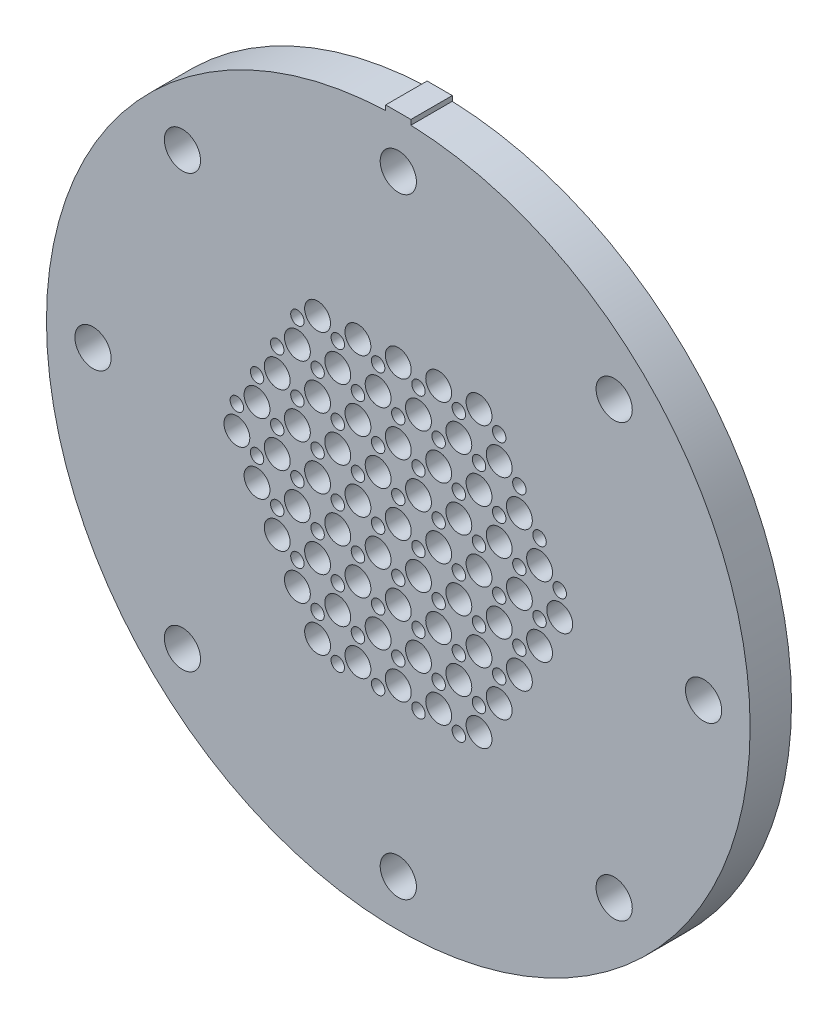
from build123d import *

# Parameters (mm, degrees)
SKETCH1_R               = 20
SKETCH1_R_2             = 1.25
SKETCH1_R_3             = 0.65
SKETCH5_R               = 34
SKETCH5_R_2             = 17.173669099
BOSS_EXTRUDE1_DEPTH     = 4
FILLET1_R               = 2
SKETCH8_R               = 1.75
CUT_EXTRUDE3_DEPTH      = 5
SKETCH10_W              = 107.605507763
SKETCH10_H              = 80.053599659
CUT_EXTRUDE4_DEPTH      = 50
SKETCH18_R              = 24
SKETCH18_R_2            = 19
CUT_EXTRUDE6_DEPTH      = 80.771517757
CUT_EXTRUDE6_DEPTH_BACK = 80.771517757
SKETCH21_R              = 20.75
CUT_EXTRUDE7_DEPTH      = 4.55
SKETCH23_R              = 30.729548531
SKETCH23_R_2            = 22.729548531
BOSS_EXTRUDE2_DEPTH     = 2.5
SKETCH24_R              = 1.6
CUT_EXTRUDE8_DEPTH      = 2.5
SKETCH27_R              = 1.75
CUT_EXTRUDE9_DEPTH      = 5
SKETCH28_W              = 2.436031958
SKETCH28_H              = 0.92316818
BOSS_EXTRUDE3_DEPTH     = 4
SKETCH29_W              = 114.781265496
SKETCH29_H              = 149.582619024
SKETCH29_W_2            = 53
SKETCH29_H_2            = 123.630711616
CUT_EXTRUDE10_DEPTH     = 3
SKETCH30_R              = 44.806445858
CUT_EXTRUDE11_DEPTH     = 60


with BuildPart() as part:
    # Sweep1: sweep along a path in Sketch2
    with BuildLine(Plane(origin=(0, 0, 0), x_dir=(0, 0, -1), z_dir=(1, 0, 0))) as sweep1_path:
        Line((0, 0), (12, 0))
        ThreePointArc((12, 0), (31.391260893, -8.032123253), (39.423384146, -27.423384146))
        Line((39.423384146, -27.423384146), (39.423384146, -34.423384146))
    # Sketch1 → Sweep1 (sweep)
    with BuildSketch(Plane.XY):
        Circle(SKETCH1_R)
        Circle(SKETCH1_R_2, mode=Mode.SUBTRACT)
        with Locations((3.9, 0)):
            Circle(SKETCH1_R_2, mode=Mode.SUBTRACT)
        with Locations((7.8, 0)):
            Circle(SKETCH1_R_2, mode=Mode.SUBTRACT)
        with Locations((11.7, 0)):
            Circle(SKETCH1_R_2, mode=Mode.SUBTRACT)
        with Locations((15.6, 0)):
            Circle(SKETCH1_R_2, mode=Mode.SUBTRACT)
        with Locations((1.95, -3.377499075)):
            Circle(SKETCH1_R_2, mode=Mode.SUBTRACT)
        with Locations((3.9, -6.75499815)):
            Circle(SKETCH1_R_2, mode=Mode.SUBTRACT)
        with Locations((5.85, -10.132497224)):
            Circle(SKETCH1_R_2, mode=Mode.SUBTRACT)
        with Locations((7.8, -13.509996299)):
            Circle(SKETCH1_R_2, mode=Mode.SUBTRACT)
        with Locations((-1.95, -3.377499075)):
            Circle(SKETCH1_R_2, mode=Mode.SUBTRACT)
        with Locations((-3.9, -6.75499815)):
            Circle(SKETCH1_R_2, mode=Mode.SUBTRACT)
        with Locations((-5.85, -10.132497224)):
            Circle(SKETCH1_R_2, mode=Mode.SUBTRACT)
        with Locations((-7.8, -13.509996299)):
            Circle(SKETCH1_R_2, mode=Mode.SUBTRACT)
        with Locations((-3.9, 0)):
            Circle(SKETCH1_R_2, mode=Mode.SUBTRACT)
        with Locations((-7.8, 0)):
            Circle(SKETCH1_R_2, mode=Mode.SUBTRACT)
        with Locations((-11.7, 0)):
            Circle(SKETCH1_R_2, mode=Mode.SUBTRACT)
        with Locations((-15.6, 0)):
            Circle(SKETCH1_R_2, mode=Mode.SUBTRACT)
        with Locations((-1.95, 3.377499075)):
            Circle(SKETCH1_R_2, mode=Mode.SUBTRACT)
        with Locations((-3.9, 6.75499815)):
            Circle(SKETCH1_R_2, mode=Mode.SUBTRACT)
        with Locations((-5.85, 10.132497224)):
            Circle(SKETCH1_R_2, mode=Mode.SUBTRACT)
        with Locations((-7.8, 13.509996299)):
            Circle(SKETCH1_R_2, mode=Mode.SUBTRACT)
        with Locations((1.95, 3.377499075)):
            Circle(SKETCH1_R_2, mode=Mode.SUBTRACT)
        with Locations((3.9, 6.75499815)):
            Circle(SKETCH1_R_2, mode=Mode.SUBTRACT)
        with Locations((5.85, 10.132497224)):
            Circle(SKETCH1_R_2, mode=Mode.SUBTRACT)
        with Locations((7.8, 13.509996299)):
            Circle(SKETCH1_R_2, mode=Mode.SUBTRACT)
        with Locations((5.85, 3.377499075)):
            Circle(SKETCH1_R_2, mode=Mode.SUBTRACT)
        with Locations((7.8, 6.75499815)):
            Circle(SKETCH1_R_2, mode=Mode.SUBTRACT)
        with Locations((9.75, 3.377499075)):
            Circle(SKETCH1_R_2, mode=Mode.SUBTRACT)
        with Locations((11.7, 6.75499815)):
            Circle(SKETCH1_R_2, mode=Mode.SUBTRACT)
        with Locations((9.749099848, 10.134056333)):
            Circle(SKETCH1_R_2, mode=Mode.SUBTRACT)
        with Locations((13.650900152, 3.375939966)):
            Circle(SKETCH1_R_2, mode=Mode.SUBTRACT)
        with Locations((5.850000208, -3.379058003)):
            Circle(SKETCH1_R_2, mode=Mode.SUBTRACT)
        with Locations((9.750000208, -3.379058003)):
            Circle(SKETCH1_R_2, mode=Mode.SUBTRACT)
        with Locations((7.800000208, -6.756557078)):
            Circle(SKETCH1_R_2, mode=Mode.SUBTRACT)
        with Locations((11.700000208, -6.756557078)):
            Circle(SKETCH1_R_2, mode=Mode.SUBTRACT)
        with Locations((9.749100056, -10.135615261)):
            Circle(SKETCH1_R_2, mode=Mode.SUBTRACT)
        with Locations((13.650900359, -3.377498895)):
            Circle(SKETCH1_R_2, mode=Mode.SUBTRACT)
        with Locations((-0.00134976, -6.757336722)):
            Circle(SKETCH1_R_2, mode=Mode.SUBTRACT)
        with Locations((1.94865024, -10.134835797)):
            Circle(SKETCH1_R_2, mode=Mode.SUBTRACT)
        with Locations((-1.95134976, -10.134835797)):
            Circle(SKETCH1_R_2, mode=Mode.SUBTRACT)
        with Locations((-0.00134976, -13.512334872)):
            Circle(SKETCH1_R_2, mode=Mode.SUBTRACT)
        with Locations((-3.903150063, -13.512334872)):
            Circle(SKETCH1_R_2, mode=Mode.SUBTRACT)
        with Locations((3.900450543, -13.512334872)):
            Circle(SKETCH1_R_2, mode=Mode.SUBTRACT)
        with Locations((-5.852699936, -3.379058363)):
            Circle(SKETCH1_R_2, mode=Mode.SUBTRACT)
        with Locations((-7.802699936, -6.756557438)):
            Circle(SKETCH1_R_2, mode=Mode.SUBTRACT)
        with Locations((-9.752699936, -3.379058363)):
            Circle(SKETCH1_R_2, mode=Mode.SUBTRACT)
        with Locations((-11.702699936, -6.756557438)):
            Circle(SKETCH1_R_2, mode=Mode.SUBTRACT)
        with Locations((-13.653600087, -3.377499255)):
            Circle(SKETCH1_R_2, mode=Mode.SUBTRACT)
        with Locations((-9.751799784, -10.135615621)):
            Circle(SKETCH1_R_2, mode=Mode.SUBTRACT)
        with Locations((-5.852700144, 3.377498715)):
            Circle(SKETCH1_R_2, mode=Mode.SUBTRACT)
        with Locations((-9.752700144, 3.377498715)):
            Circle(SKETCH1_R_2, mode=Mode.SUBTRACT)
        with Locations((-7.802700144, 6.75499779)):
            Circle(SKETCH1_R_2, mode=Mode.SUBTRACT)
        with Locations((-11.702700144, 6.75499779)):
            Circle(SKETCH1_R_2, mode=Mode.SUBTRACT)
        with Locations((-9.751799992, 10.134055973)):
            Circle(SKETCH1_R_2, mode=Mode.SUBTRACT)
        with Locations((-13.653600295, 3.375939606)):
            Circle(SKETCH1_R_2, mode=Mode.SUBTRACT)
        with Locations((-0.001350176, 6.755777434)):
            Circle(SKETCH1_R_2, mode=Mode.SUBTRACT)
        with Locations((-1.951350176, 10.133276509)):
            Circle(SKETCH1_R_2, mode=Mode.SUBTRACT)
        with Locations((1.948649824, 10.133276509)):
            Circle(SKETCH1_R_2, mode=Mode.SUBTRACT)
        with Locations((-0.001350176, 13.510775583)):
            Circle(SKETCH1_R_2, mode=Mode.SUBTRACT)
        with Locations((3.900450128, 13.510775583)):
            Circle(SKETCH1_R_2, mode=Mode.SUBTRACT)
        with Locations((-3.903150479, 13.510775583)):
            Circle(SKETCH1_R_2, mode=Mode.SUBTRACT)
        with Locations((13.65, -1.125833025)):
            Circle(SKETCH1_R_3, mode=Mode.SUBTRACT)
        with Locations((11.700900359, -4.504371325)):
            Circle(SKETCH1_R_3, mode=Mode.SUBTRACT)
        with Locations((9.750000208, -7.883429509)):
            Circle(SKETCH1_R_3, mode=Mode.SUBTRACT)
        with Locations((7.798650344, -11.259109473)):
            Circle(SKETCH1_R_3, mode=Mode.SUBTRACT)
        with Locations((9.75, -1.125833025)):
            Circle(SKETCH1_R_3, mode=Mode.SUBTRACT)
        with Locations((7.800900359, -4.504371325)):
            Circle(SKETCH1_R_3, mode=Mode.SUBTRACT)
        with Locations((5.850000208, -7.883429509)):
            Circle(SKETCH1_R_3, mode=Mode.SUBTRACT)
        with Locations((3.898650344, -11.259109473)):
            Circle(SKETCH1_R_3, mode=Mode.SUBTRACT)
        with Locations((5.85, -1.125833025)):
            Circle(SKETCH1_R_3, mode=Mode.SUBTRACT)
        with Locations((3.900900359, -4.504371325)):
            Circle(SKETCH1_R_3, mode=Mode.SUBTRACT)
        with Locations((1.950000208, -7.883429509)):
            Circle(SKETCH1_R_3, mode=Mode.SUBTRACT)
        with Locations((-0.001349656, -11.259109473)):
            Circle(SKETCH1_R_3, mode=Mode.SUBTRACT)
        with Locations((1.95, -1.125833025)):
            Circle(SKETCH1_R_3, mode=Mode.SUBTRACT)
        with Locations((0.000900359, -4.504371325)):
            Circle(SKETCH1_R_3, mode=Mode.SUBTRACT)
        with Locations((-1.949999792, -7.883429509)):
            Circle(SKETCH1_R_3, mode=Mode.SUBTRACT)
        with Locations((-3.901349656, -11.259109473)):
            Circle(SKETCH1_R_3, mode=Mode.SUBTRACT)
        with Locations((-1.95, -1.125833025)):
            Circle(SKETCH1_R_3, mode=Mode.SUBTRACT)
        with Locations((-3.899099641, -4.504371325)):
            Circle(SKETCH1_R_3, mode=Mode.SUBTRACT)
        with Locations((-5.849999792, -7.883429509)):
            Circle(SKETCH1_R_3, mode=Mode.SUBTRACT)
        with Locations((-7.801349656, -11.259109473)):
            Circle(SKETCH1_R_3, mode=Mode.SUBTRACT)
        with Locations((-5.85, -1.125833025)):
            Circle(SKETCH1_R_3, mode=Mode.SUBTRACT)
        with Locations((-7.799099641, -4.504371325)):
            Circle(SKETCH1_R_3, mode=Mode.SUBTRACT)
        with Locations((-9.749999792, -7.883429509)):
            Circle(SKETCH1_R_3, mode=Mode.SUBTRACT)
        with Locations((-9.75, -1.125833025)):
            Circle(SKETCH1_R_3, mode=Mode.SUBTRACT)
        with Locations((-11.699099641, -4.504371325)):
            Circle(SKETCH1_R_3, mode=Mode.SUBTRACT)
        with Locations((-13.65, -1.125833025)):
            Circle(SKETCH1_R_3, mode=Mode.SUBTRACT)
        with Locations((0, 2.25166605)):
            Circle(SKETCH1_R_3, mode=Mode.SUBTRACT)
        with Locations((3.9, 2.25166605)):
            Circle(SKETCH1_R_3, mode=Mode.SUBTRACT)
        with Locations((7.8, 2.25166605)):
            Circle(SKETCH1_R_3, mode=Mode.SUBTRACT)
        with Locations((11.7, 2.25166605)):
            Circle(SKETCH1_R_3, mode=Mode.SUBTRACT)
        with Locations((15.6, 2.25166605)):
            Circle(SKETCH1_R_3, mode=Mode.SUBTRACT)
        with Locations((1.949100056, 5.629684708)):
            Circle(SKETCH1_R_3, mode=Mode.SUBTRACT)
        with Locations((5.849100056, 5.629684708)):
            Circle(SKETCH1_R_3, mode=Mode.SUBTRACT)
        with Locations((9.749100056, 5.629684708)):
            Circle(SKETCH1_R_3, mode=Mode.SUBTRACT)
        with Locations((13.649100056, 5.629684708)):
            Circle(SKETCH1_R_3, mode=Mode.SUBTRACT)
        with Locations((3.899100056, 9.007183782)):
            Circle(SKETCH1_R_3, mode=Mode.SUBTRACT)
        with Locations((7.799100056, 9.007183782)):
            Circle(SKETCH1_R_3, mode=Mode.SUBTRACT)
        with Locations((11.699100056, 9.007183782)):
            Circle(SKETCH1_R_3, mode=Mode.SUBTRACT)
        with Locations((5.85, 12.384163274)):
            Circle(SKETCH1_R_3, mode=Mode.SUBTRACT)
        with Locations((9.75, 12.384163274)):
            Circle(SKETCH1_R_3, mode=Mode.SUBTRACT)
        with Locations((5.85, -14.635829324)):
            Circle(SKETCH1_R_3, mode=Mode.SUBTRACT)
        with Locations((1.950899944, -14.635309741)):
            Circle(SKETCH1_R_3, mode=Mode.SUBTRACT)
        with Locations((-1.949100056, -14.635309741)):
            Circle(SKETCH1_R_3, mode=Mode.SUBTRACT)
        with Locations((-5.85, -14.635829324)):
            Circle(SKETCH1_R_3, mode=Mode.SUBTRACT)
        with Locations((-15.6, 2.25166605)):
            Circle(SKETCH1_R_3, mode=Mode.SUBTRACT)
        with Locations((-13.65, 5.628125959)):
            Circle(SKETCH1_R_3, mode=Mode.SUBTRACT)
        with Locations((-11.7, 9.005625033)):
            Circle(SKETCH1_R_3, mode=Mode.SUBTRACT)
        with Locations((-9.75, 12.384163274)):
            Circle(SKETCH1_R_3, mode=Mode.SUBTRACT)
        with Locations((-5.85, 12.384163274)):
            Circle(SKETCH1_R_3, mode=Mode.SUBTRACT)
        with Locations((-1.95, 12.384163274)):
            Circle(SKETCH1_R_3, mode=Mode.SUBTRACT)
        with Locations((1.95, 12.384163274)):
            Circle(SKETCH1_R_3, mode=Mode.SUBTRACT)
        with Locations((-7.8, 9.005625033)):
            Circle(SKETCH1_R_3, mode=Mode.SUBTRACT)
        with Locations((-9.75, 5.628125959)):
            Circle(SKETCH1_R_3, mode=Mode.SUBTRACT)
        with Locations((-11.7, 2.25166605)):
            Circle(SKETCH1_R_3, mode=Mode.SUBTRACT)
        with Locations((-3.9, 9.005625033)):
            Circle(SKETCH1_R_3, mode=Mode.SUBTRACT)
        with Locations((-5.85, 5.628125959)):
            Circle(SKETCH1_R_3, mode=Mode.SUBTRACT)
        with Locations((-7.8, 2.25166605)):
            Circle(SKETCH1_R_3, mode=Mode.SUBTRACT)
        with Locations((0, 9.005625033)):
            Circle(SKETCH1_R_3, mode=Mode.SUBTRACT)
        with Locations((-1.95, 5.628125959)):
            Circle(SKETCH1_R_3, mode=Mode.SUBTRACT)
        with Locations((-3.9, 2.25166605)):
            Circle(SKETCH1_R_3, mode=Mode.SUBTRACT)
    sweep(path=sweep1_path.line)

    # Sketch5 → Boss-Extrude1 (add)
    with BuildSketch(Plane.XY):
        Circle(SKETCH5_R)
        Circle(SKETCH5_R_2, mode=Mode.SUBTRACT)
    extrude(amount=-BOSS_EXTRUDE1_DEPTH)

    # Fillet1
    fillet1_edges = [part.edges().sort_by_distance(p)[0] for p in [
        (-20, 0, -4),
    ]]
    fillet(fillet1_edges, radius=FILLET1_R)

    # Sketch8 → Cut-Extrude3 (cut)
    with BuildSketch(Plane.XY):
        with Locations((-20.859650045, 20.859650045)):
            Circle(SKETCH8_R)
        with Locations((20.859650045, 20.859650045)):
            Circle(SKETCH8_R)
        with Locations((20.859650045, -20.859650045)):
            Circle(SKETCH8_R)
        with Locations((-20.859650045, -20.859650045)):
            Circle(SKETCH8_R)
    extrude(amount=-CUT_EXTRUDE3_DEPTH, mode=Mode.SUBTRACT)

    # Sketch10 → Cut-Extrude4 (cut)
    with BuildSketch(Plane.XY.offset(-10)):
        with Locations((7.049168622, 0.788612068)):
            Rectangle(SKETCH10_W, SKETCH10_H)
    extrude(amount=-CUT_EXTRUDE4_DEPTH, mode=Mode.SUBTRACT)

    # Sweep2: sweep along a path in Sketch2<2>
    with BuildLine(Plane(origin=(0, 0, 0), x_dir=(0, 0, -1), z_dir=(1, 0, 0))) as sweep2_path:
        Line((0, 0), (12, 0))
        ThreePointArc((12, 0), (31.391260893, -8.032123253), (39.423384146, -27.423384146))
        Line((39.423384146, -27.423384146), (39.423384146, -34.423384146))
    # Sketch18 → Sweep2 (sweep)
    with BuildSketch(Plane.XY):
        Circle(SKETCH18_R)
        Circle(SKETCH18_R_2, mode=Mode.SUBTRACT)
    sweep(path=sweep2_path.line)

    # Sketch9 → Cut-Extrude6 (cut, two sides: drawn at the far end of the back side and taken through both)
    with BuildSketch(Plane(origin=(0, 0, 0), x_dir=(0, 0, -1), z_dir=(1, 0, 0)).offset(-CUT_EXTRUDE6_DEPTH_BACK)):
        Polygon((17.249125269, -22.174258877), (55.092197309, 18.379670426), (79.742003971, -4.62240176), (81.44279688, -51.391669716), (9.251283321, -51.391669716), (8.528618039, -31.519452452), align=None)
    extrude(amount=CUT_EXTRUDE6_DEPTH + CUT_EXTRUDE6_DEPTH_BACK, mode=Mode.SUBTRACT)

    # Sketch21 → Cut-Extrude7 (cut)
    with BuildSketch(Plane(origin=(0, -18.92525353, -20.280948462), x_dir=(-1, 0, 0), z_dir=(0, -0.6822482773295654, -0.7311205701393174))):
        with Locations((0.001350176, 15.34834156)):
            Circle(SKETCH21_R)
    extrude(amount=-CUT_EXTRUDE7_DEPTH, mode=Mode.SUBTRACT)

    # Sketch23 → Boss-Extrude2 (add)
    with BuildSketch(Plane(origin=(0, -18.92525353, -20.280948462), x_dir=(-1, 0, 0), z_dir=(0, -0.6822482773295654, -0.7311205701393174))):
        with Locations((0.001350176, 15.786588008)):
            Circle(SKETCH23_R)
        with Locations((0.001350176, 15.786588008)):
            Circle(SKETCH23_R_2, mode=Mode.SUBTRACT)
    extrude(amount=-BOSS_EXTRUDE2_DEPTH)

    # Sketch24 → Cut-Extrude8 (cut)
    with BuildSketch(Plane(origin=(0, -17.219632836, -18.453147036), x_dir=(1, 0, 0), z_dir=(0, 0.6822482773295654, 0.7311205701393173))):
        with Locations((-2.53e-06, 42.787822162)):
            Circle(SKETCH24_R)
        with Locations((23.38200952, 29.286655083)):
            Circle(SKETCH24_R)
        with Locations((23.380661875, 2.286655117)):
            Circle(SKETCH24_R)
        with Locations((-0.002697821, -11.212177771)):
            Circle(SKETCH24_R)
        with Locations((-23.384709872, 2.288989308)):
            Circle(SKETCH24_R)
        with Locations((-23.383362226, 29.288989274)):
            Circle(SKETCH24_R)
    extrude(amount=-CUT_EXTRUDE8_DEPTH, mode=Mode.SUBTRACT)

    # Sketch27 → Cut-Extrude9 (cut)
    with BuildSketch(Plane.XY):
        with Locations((0, 29.5)):
            Circle(SKETCH27_R)
        with Locations((29.5, 0)):
            Circle(SKETCH27_R)
        with Locations((0, -29.5)):
            Circle(SKETCH27_R)
        with Locations((-29.5, 0)):
            Circle(SKETCH27_R)
    extrude(amount=-CUT_EXTRUDE9_DEPTH, mode=Mode.SUBTRACT)

    # Sketch28 → Boss-Extrude3 (add)
    with BuildSketch(Plane.XY):
        with Locations((0, 34)):
            Rectangle(SKETCH28_W, SKETCH28_H)
    extrude(amount=-BOSS_EXTRUDE3_DEPTH)

    # Sketch29 → Cut-Extrude10 (cut)
    with BuildSketch(Plane(origin=(0, -18.92525353, -20.280948462), x_dir=(-1, 0, 0), z_dir=(0, -0.6822482773295654, -0.7311205701393174))):
        Rectangle(SKETCH29_W, SKETCH29_H)
        Rectangle(SKETCH29_W_2, SKETCH29_H_2, mode=Mode.SUBTRACT)
    extrude(amount=-CUT_EXTRUDE10_DEPTH, mode=Mode.SUBTRACT)

    # Sketch30 → Cut-Extrude11 (cut)
    with BuildSketch(Plane(origin=(0, 0, -4), x_dir=(-1, 0, 0), z_dir=(0, 0, -1))):
        Circle(SKETCH30_R)
    extrude(amount=CUT_EXTRUDE11_DEPTH, mode=Mode.SUBTRACT)


solid = part.part
